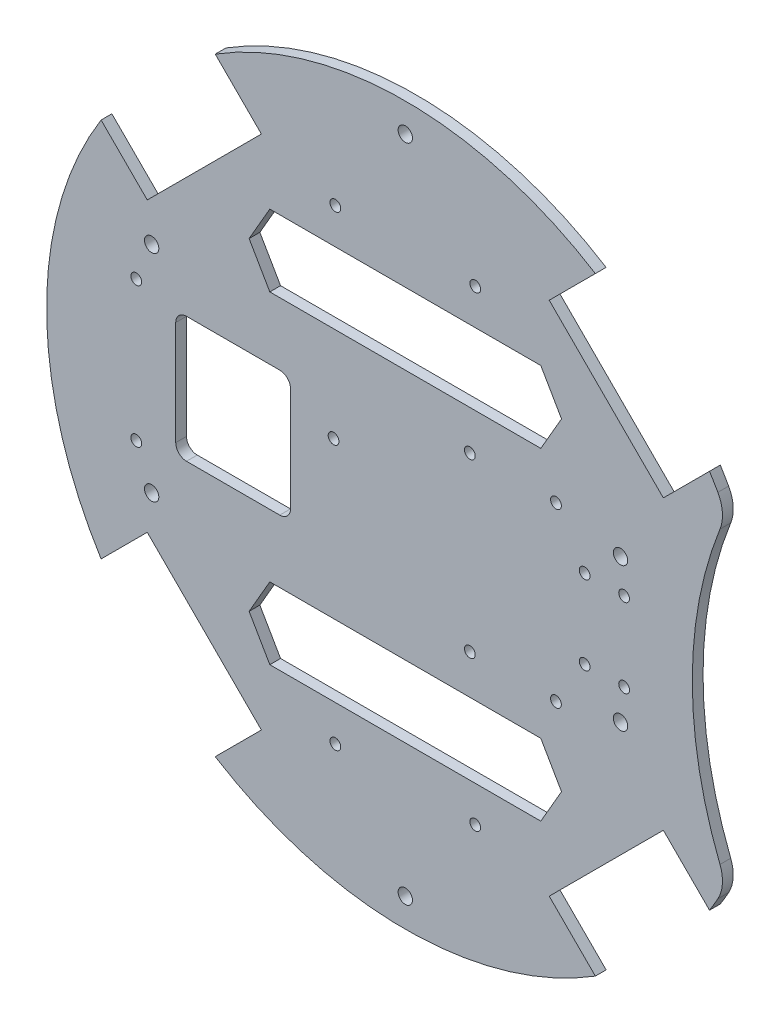
from build123d import *

# Parameters (mm, degrees)
CROQUIS1_R              = 100
SALIENTE_EXTRUIR1_DEPTH = 3
CROQUIS3_R              = 110
CORTAR_EXTRUIR1_DEPTH   = 3
REDONDEO1_R             = 10
CORTAR_EXTRUIR3_DEPTH   = 10
CROQUIS10_R             = 1.5
CORTAR_EXTRUIR4_DEPTH   = 142.453172607
CROQUIS12_R             = 1.5
CORTAR_EXTRUIR6_DEPTH   = 142.453172607
CROQUIS13_R             = 2
CORTAR_EXTRUIR7_DEPTH   = 142.453172607
CROQUIS15_W             = 32
CROQUIS15_H             = 35
CORTAR_EXTRUIR8_DEPTH   = 142.453172607
REDONDEO2_R             = 3
CROQUIS16_R             = 1.5
CORTAR_EXTRUIR9_DEPTH   = 142.453172607


with BuildPart() as part:
    # Croquis1 → Saliente-Extruir1 (new body)
    with BuildSketch(Plane.XY):
        Circle(CROQUIS1_R)
    extrude(amount=SALIENTE_EXTRUIR1_DEPTH)

    # Croquis3 → Cortar-Extruir1 (cut)
    with BuildSketch(Plane.XY.offset(3)):
        with Locations((190, 0)):
            Circle(CROQUIS3_R)
    extrude(amount=-CORTAR_EXTRUIR1_DEPTH, mode=Mode.SUBTRACT)

    # Redondeo1
    redondeo1_edges = [part.edges().sort_by_distance(p)[0] for p in [
        (89.473684211, -44.659375654, 1.5),
        (89.473684211, 44.659375654, 1.5),
    ]]
    fillet(redondeo1_edges, radius=REDONDEO1_R)

    # Croquis7 → Cortar-Extruir3 (cut)
    with BuildSketch(Plane.XY.offset(3)):
        Polygon((-71.939339828, -40.119534675), (-40.119534675, -71.939339828), (-57.797204204, -89.617009358), (-89.617009358, -57.797204204), align=None)
        Polygon((-40.119534675, 71.939339828), (-71.939339828, 40.119534675), (-89.617009358, 57.797204204), (-57.797204204, 89.617009358), align=None)
        Polygon((71.939339828, 40.119534675), (40.119534675, 71.939339828), (57.797204204, 89.617009358), (89.617009358, 57.797204204), align=None)
        Polygon((40.119534675, -71.939339828), (71.939339828, -40.119534675), (89.617009358, -57.797204204), (57.797204204, -89.617009358), align=None)
    extrude(amount=-CORTAR_EXTRUIR3_DEPTH, mode=Mode.SUBTRACT)

    # Croquis10 → Cortar-Extruir4 (cut, through all)
    with BuildSketch(Plane.XY.offset(3)):
        with Locations((-20, 8.5)):
            Circle(CROQUIS10_R)
    extrude(amount=-CORTAR_EXTRUIR4_DEPTH, mode=Mode.SUBTRACT)

    # Croquis12 → Cortar-Extruir6 (cut, through all)
    with BuildSketch(Plane(origin=(0, 0, 0), x_dir=(-1, 0, 0), z_dir=(0, 0, -1))):
        with Locations((-61, 11)):
            Circle(CROQUIS12_R)
        with Locations((-61, -11)):
            Circle(CROQUIS12_R)
        with Locations((-50, 11)):
            Circle(CROQUIS12_R)
        with Locations((-50, -11)):
            Circle(CROQUIS12_R)
    extrude(amount=-CORTAR_EXTRUIR6_DEPTH, mode=Mode.SUBTRACT)

    # Croquis13 → Cortar-Extruir7 (cut, through all)
    with BuildSketch(Plane(origin=(0, 0, 0), x_dir=(-1, 0, 0), z_dir=(0, 0, -1))):
        with Locations((0, 92)):
            Circle(CROQUIS13_R)
        with Locations((0, -92)):
            Circle(CROQUIS13_R)
        with Locations((70.711068531, 30)):
            Circle(CROQUIS13_R)
        with Locations((70.711643931, -30)):
            Circle(CROQUIS13_R)
        with Locations((-60, 20)):
            Circle(CROQUIS13_R)
        with Locations((-60, -20)):
            Circle(CROQUIS13_R)
    extrude(amount=-CORTAR_EXTRUIR7_DEPTH, mode=Mode.SUBTRACT)

    # Croquis15 → Cortar-Extruir8 (cut, through all)
    with BuildSketch(Plane(origin=(0, 0, 0), x_dir=(-1, 0, 0), z_dir=(0, 0, -1))):
        Polygon((-37.773502692, 55), (-43.547005384, 45), (-37.773502692, 35), (37.773502692, 35), (43.547005384, 45), (37.773502692, 55), align=None)
        Polygon((43.547005384, -45), (37.773502692, -35), (-37.773502692, -35), (-43.547005384, -45), (-37.773502692, -55), (37.773502692, -55), align=None)
        with Locations((48, 0)):
            Rectangle(CROQUIS15_W, CROQUIS15_H)
    extrude(amount=-CORTAR_EXTRUIR8_DEPTH, mode=Mode.SUBTRACT)

    # Redondeo2
    redondeo2_edges = [part.edges().sort_by_distance(p)[0] for p in [
        (-64, -17.5, 1.5),
        (-32, -17.5, 1.5),
        (-64, 17.5, 1.5),
        (-32, 17.5, 1.5),
    ]]
    fillet(redondeo2_edges, radius=REDONDEO2_R)

    # Croquis16 → Cortar-Extruir9 (cut, through all)
    with BuildSketch(Plane(origin=(0, 0, 0), x_dir=(-1, 0, 0), z_dir=(0, 0, -1))):
        with Locations((-19.5, 65)):
            Circle(CROQUIS16_R)
        with Locations((19.5, 65)):
            Circle(CROQUIS16_R)
        with Locations((19.5, -65)):
            Circle(CROQUIS16_R)
        with Locations((-19.5, -65)):
            Circle(CROQUIS16_R)
        with Locations((-42, 24)):
            Circle(CROQUIS16_R)
        with Locations((-42, -24)):
            Circle(CROQUIS16_R)
        with Locations((-18, -24)):
            Circle(CROQUIS16_R)
        with Locations((-18, 24)):
            Circle(CROQUIS16_R)
        with Locations((75, 19.5)):
            Circle(CROQUIS16_R)
        with Locations((75, -19.5)):
            Circle(CROQUIS16_R)
    extrude(amount=-CORTAR_EXTRUIR9_DEPTH, mode=Mode.SUBTRACT)


solid = part.part
